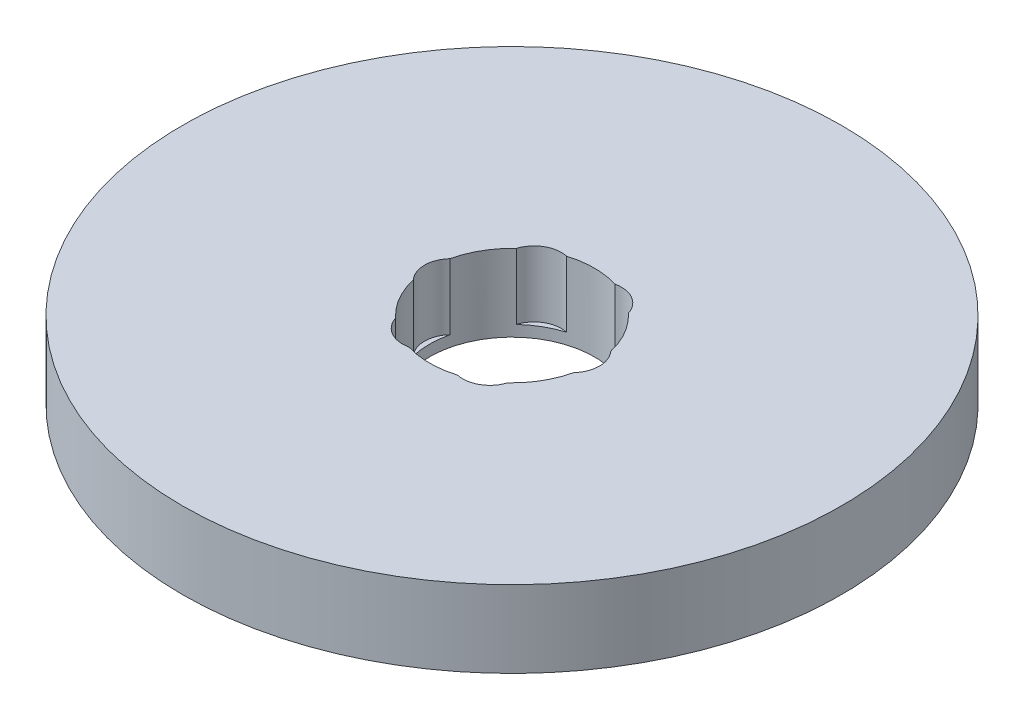
from build123d import *

# Parameters (mm, degrees)
SKETCH1_R           = 90
BOSS_EXTRUDE1_DEPTH = 21
SKETCH2_R           = 22.5
CUT_EXTRUDE1_DEPTH  = 130
SKETCH3_R           = 7.430041187
CUT_EXTRUDE2_DEPTH  = 17.987710474
CIRPATTERN1_COUNT   = 6


with BuildPart() as part:
    # Sketch1 → Boss-Extrude1 (new body)
    with BuildSketch(Plane(origin=(0, 0, 0), x_dir=(1, 0, 0), z_dir=(0, 1, 0))):
        Circle(SKETCH1_R)
    extrude(amount=BOSS_EXTRUDE1_DEPTH)

    # Sketch2 → Cut-Extrude1 (cut, through all)
    with BuildSketch(Plane(origin=(0, 0, 0), x_dir=(1, 0, 0), z_dir=(0, 1, 0))):
        Circle(SKETCH2_R)
    extrude(amount=CUT_EXTRUDE1_DEPTH, mode=Mode.SUBTRACT)

    # Sketch3 → Cut-Extrude2 (cut)
    with BuildSketch(Plane(origin=(0, 21, 0), x_dir=(1, 0, 0), z_dir=(0, 1, 0))):
        with Locations((-16.457930172, 0)):
            Circle(SKETCH3_R)
    cut_extrude2 = extrude(amount=-CUT_EXTRUDE2_DEPTH, mode=Mode.SUBTRACT)

    # CirPattern1: Cut-Extrude2 ×6 about axis
    cirpattern1_axis = Axis((0, 0, 0), (0, 1, 0))
    for i in range(1, CIRPATTERN1_COUNT):
        add(cut_extrude2.rotate(cirpattern1_axis, i * 360 / CIRPATTERN1_COUNT), mode=Mode.SUBTRACT)


solid = part.part
